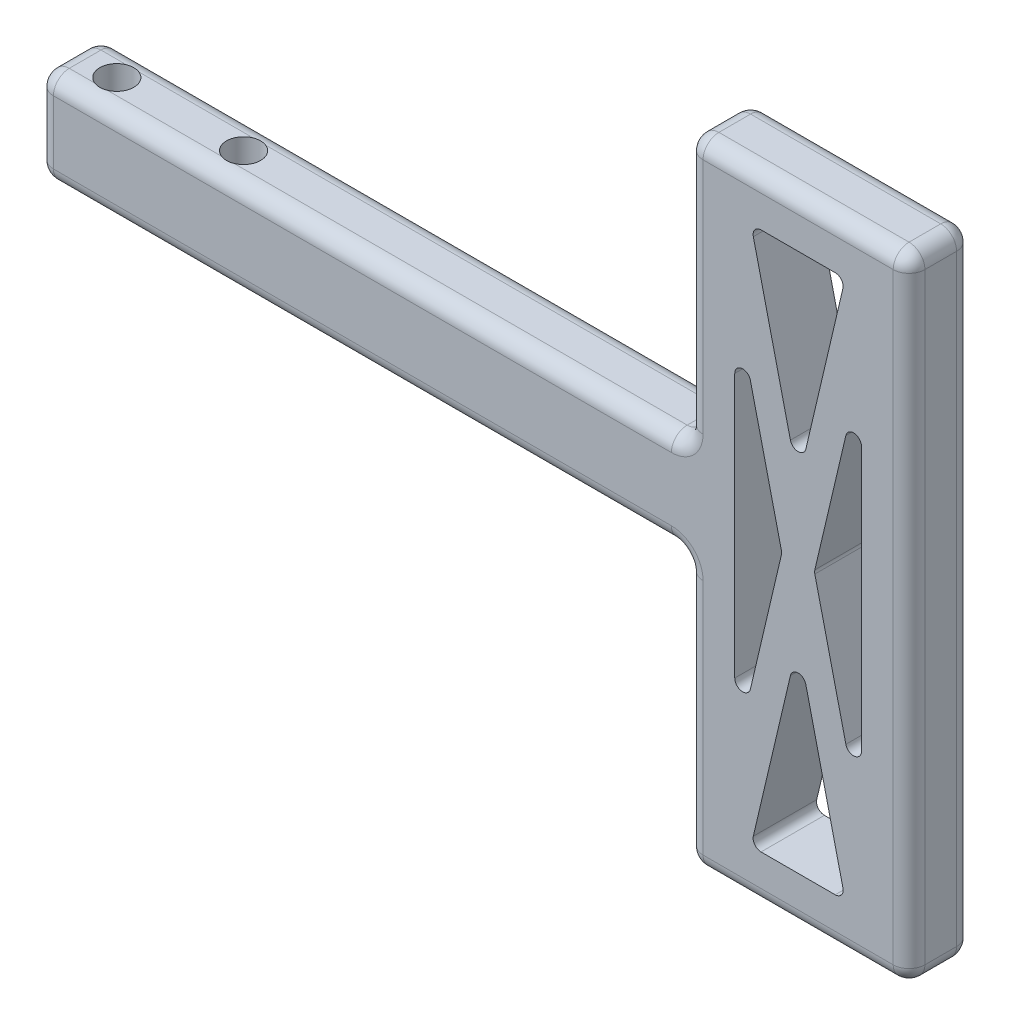
from build123d import *

# Parameters (mm, degrees)
BOSS_EXTRUDE1_DEPTH = 8
SKETCH2_R           = 2.15
CUT_EXTRUDE1_DEPTH  = 18
FILLET1_R           = 2
FILLET2_R           = 1


with BuildPart() as part:
    # Sketch1 → Boss-Extrude1 (new body)
    with BuildSketch(Plane.XY):
        Polygon((76, -6), (76, -40), (104, -40), (104, 40), (76, 40), (76, 6), (-6, 6), (-6, -6), align=None)
        Polygon((84.054617553, 34), (90, 8.732124598), (95.945382447, 34), align=None, mode=Mode.SUBTRACT)
        Polygon((82, 25.267875402), (82, -25.267875402), (87.945382447, 0), align=None, mode=Mode.SUBTRACT)
        Polygon((98, 25.267875402), (92.054617553, 0), (98, -25.267875402), align=None, mode=Mode.SUBTRACT)
        Polygon((84.054617553, -34), (95.945382447, -34), (90, -8.732124598), align=None, mode=Mode.SUBTRACT)
    extrude(amount=BOSS_EXTRUDE1_DEPTH)

    # Sketch2 → Cut-Extrude1 (cut)
    with BuildSketch(Plane.XZ.offset(6)):
        with Locations(Location((0, 4, 0), (0, 0, 270))):
            Circle(SKETCH2_R)
        with Locations(Location((16, 4, 0), (0, 0, 270))):
            Circle(SKETCH2_R)
    extrude(amount=-CUT_EXTRUDE1_DEPTH, mode=Mode.SUBTRACT)

    # Fillet1
    # the kernel refuses this fillet: 2 mm, written as the material it adds along each edge
    with BuildSketch(Plane(origin=(76, 6, 0), x_dir=(0, 1, 0), z_dir=(0, 0, 1))) as fillet1_piece_1:
        with BuildLine():
            CenterArc((FILLET1_R, FILLET1_R), FILLET1_R, 180, 90)
            Line((0, FILLET1_R), (0, 0))
            Line((0, 0), (FILLET1_R, 0))
        make_face()
    extrude(amount=8)
    with BuildSketch(Plane(origin=(76, -6, 0), x_dir=(0, -1, 0), z_dir=(0, 0, 1))) as fillet1_piece_2:
        with BuildLine():
            CenterArc((FILLET1_R, -FILLET1_R), FILLET1_R, 90, 90)
            Line((0, -FILLET1_R), (0, 0))
            Line((0, 0), (FILLET1_R, 0))
        make_face()
    extrude(amount=8)
    # the kernel refuses this fillet: 2 mm, written as the material it takes off along each edge
    with BuildSketch(Plane(origin=(102, -38, 2), x_dir=(0, -1, 0), z_dir=(0, 0, -1))) as fillet1_2_piece_1_section:
        Polygon((0, 0), (FILLET1_R, 0), (FILLET1_R, -FILLET1_R), (0, -FILLET1_R), align=None)
    fillet1_2_piece_1 = extrude(amount=FILLET1_R, mode=Mode.PRIVATE)
    fillet1_2_piece_1 = fillet1_2_piece_1 - Plane(origin=(102, -38, 2), x_dir=(-0.7071067811865475, 0.7071067811865475, 0), z_dir=(0, 0, -1)) * Sphere(FILLET1_R, mode=Mode.PRIVATE)
    add(fillet1_2_piece_1, mode=Mode.SUBTRACT)
    with BuildSketch(Plane(origin=(102, 38, 2), x_dir=(1, 0, 0), z_dir=(0, 0, -1))) as fillet1_2_piece_2_section:
        Polygon((0, 0), (FILLET1_R, 0), (FILLET1_R, -FILLET1_R), (0, -FILLET1_R), align=None)
    fillet1_2_piece_2 = extrude(amount=FILLET1_R, mode=Mode.PRIVATE)
    fillet1_2_piece_2 = fillet1_2_piece_2 - Plane(origin=(102, 38, 2), x_dir=(-0.7071067811865475, -0.7071067811865475, 0), z_dir=(0, 0, -1)) * Sphere(FILLET1_R, mode=Mode.PRIVATE)
    add(fillet1_2_piece_2, mode=Mode.SUBTRACT)
    with BuildSketch(Plane(origin=(102, 38, 6), x_dir=(1, 0, 0), z_dir=(0, 0, 1))) as fillet1_2_piece_3_section:
        Polygon((0, 0), (FILLET1_R, 0), (FILLET1_R, FILLET1_R), (0, FILLET1_R), align=None)
    fillet1_2_piece_3 = extrude(amount=FILLET1_R, mode=Mode.PRIVATE)
    fillet1_2_piece_3 = fillet1_2_piece_3 - Plane(origin=(102, 38, 6), x_dir=(-0.7071067811865475, -0.7071067811865475, 0), z_dir=(0, 0, 1)) * Sphere(FILLET1_R, mode=Mode.PRIVATE)
    add(fillet1_2_piece_3, mode=Mode.SUBTRACT)
    with BuildSketch(Plane(origin=(102, -38, 6), x_dir=(0, 0, 1), z_dir=(0, -1, 0))) as fillet1_2_piece_4_section:
        Polygon((0, 0), (FILLET1_R, 0), (FILLET1_R, -FILLET1_R), (0, -FILLET1_R), align=None)
    fillet1_2_piece_4 = extrude(amount=FILLET1_R, mode=Mode.PRIVATE)
    fillet1_2_piece_4 = fillet1_2_piece_4 - Plane(origin=(102, -38, 6), x_dir=(-0.7071067811865475, 0, -0.7071067811865475), z_dir=(0, -1, 0)) * Sphere(FILLET1_R, mode=Mode.PRIVATE)
    add(fillet1_2_piece_4, mode=Mode.SUBTRACT)
    with BuildSketch(Plane(origin=(71, -40, 0), x_dir=(0, 1, 0), z_dir=(1, 0, 0)), Plane(origin=(71, -40, 8), x_dir=(0, 0, -1), z_dir=(1, 0, 0)), Plane(origin=(102, 40, 0), x_dir=(0, -1, 0), z_dir=(-1, 0, 0))) as fillet1_2_piece_5:
        with BuildLine():
            CenterArc((FILLET1_R, FILLET1_R), FILLET1_R, 180, 90)
            Line((0, FILLET1_R), (0, 0))
            Line((0, 0), (FILLET1_R, 0))
        make_face()
    extrude(amount=31, mode=Mode.SUBTRACT)
    with BuildSketch(Plane(origin=(-6, 11, 0), x_dir=(1, 0, 0), z_dir=(0, -1, 0))) as fillet1_2_piece_6:
        with BuildLine():
            CenterArc((FILLET1_R, FILLET1_R), FILLET1_R, 180, 90)
            Line((0, FILLET1_R), (0, 0))
            Line((0, 0), (FILLET1_R, 0))
        make_face()
    extrude(amount=22, mode=Mode.SUBTRACT)
    with BuildSketch(Plane(origin=(-6, 6, -5), x_dir=(1, 0, 0), z_dir=(0, 0, 1)), Plane(origin=(76, 40, -5), x_dir=(1, 0, 0), z_dir=(0, 0, 1)), Plane(origin=(76, -40, -5), x_dir=(0, 1, 0), z_dir=(0, 0, 1)), Plane(origin=(-6, -6, -5), x_dir=(0, 1, 0), z_dir=(0, 0, 1))) as fillet1_2_piece_7:
        with BuildLine():
            CenterArc((FILLET1_R, -FILLET1_R), FILLET1_R, 90, 90)
            Line((0, -FILLET1_R), (0, 0))
            Line((0, 0), (FILLET1_R, 0))
        make_face()
    extrude(amount=18, mode=Mode.SUBTRACT)
    with BuildSketch(Plane(origin=(104, 40, 2), x_dir=(0, -1, 0), z_dir=(0, 0, 1)), Plane(origin=(104, -40, 2), x_dir=(-1, 0, 0), z_dir=(0, 0, 1))) as fillet1_2_piece_8:
        with BuildLine():
            CenterArc((FILLET1_R, -FILLET1_R), FILLET1_R, 90, 90)
            Line((0, -FILLET1_R), (0, 0))
            Line((0, 0), (FILLET1_R, 0))
        make_face()
    extrude(amount=4, mode=Mode.SUBTRACT)
    with BuildSketch(Plane(origin=(104, -38, 8), x_dir=(-1, 0, 0), z_dir=(0, 1, 0))) as fillet1_2_piece_9:
        with BuildLine():
            CenterArc((FILLET1_R, -FILLET1_R), FILLET1_R, 90, 90)
            Line((0, -FILLET1_R), (0, 0))
            Line((0, 0), (FILLET1_R, 0))
        make_face()
    extrude(amount=76, mode=Mode.SUBTRACT)
    with BuildSketch(Plane(origin=(102, 40, 8), x_dir=(0, -1, 0), z_dir=(-1, 0, 0))) as fillet1_2_piece_10:
        with BuildLine():
            CenterArc((FILLET1_R, -FILLET1_R), FILLET1_R, 90, 90)
            Line((0, -FILLET1_R), (0, 0))
            Line((0, 0), (FILLET1_R, 0))
        make_face()
    extrude(amount=31, mode=Mode.SUBTRACT)
    with BuildSketch(Plane(origin=(-6, 11, 8), x_dir=(1, 0, 0), z_dir=(0, -1, 0))) as fillet1_2_piece_11:
        with BuildLine():
            CenterArc((FILLET1_R, -FILLET1_R), FILLET1_R, 90, 90)
            Line((0, -FILLET1_R), (0, 0))
            Line((0, 0), (FILLET1_R, 0))
        make_face()
    extrude(amount=22, mode=Mode.SUBTRACT)
    with BuildSketch(Plane(origin=(104, -38, 0), x_dir=(-1, 0, 0), z_dir=(0, 1, 0))) as fillet1_2_piece_12:
        with BuildLine():
            CenterArc((FILLET1_R, FILLET1_R), FILLET1_R, 180, 90)
            Line((0, FILLET1_R), (0, 0))
            Line((0, 0), (FILLET1_R, 0))
        make_face()
    extrude(amount=76, mode=Mode.SUBTRACT)
    # the kernel refuses this fillet: 2 mm, written as the material it takes off along each edge
    with BuildSketch(Plane(origin=(78, 38, 2), x_dir=(-1, 0, 0), z_dir=(0, 0, -1))) as fillet1_3_piece_1_section:
        Polygon((0, 0), (FILLET1_R, 0), (FILLET1_R, FILLET1_R), (0, FILLET1_R), align=None)
    fillet1_3_piece_1 = extrude(amount=FILLET1_R, mode=Mode.PRIVATE)
    fillet1_3_piece_1 = fillet1_3_piece_1 - Plane(origin=(78, 38, 2), x_dir=(0.7071067811865474, -0.7071067811865477, 0), z_dir=(0, 0, -1)) * Sphere(FILLET1_R, mode=Mode.PRIVATE)
    add(fillet1_3_piece_1, mode=Mode.SUBTRACT)
    with BuildSketch(Plane(origin=(-4, -4, 6), x_dir=(0, -1, 0), z_dir=(0, 0, 1))) as fillet1_3_piece_2_section:
        Polygon((0, 0), (FILLET1_R, 0), (FILLET1_R, -FILLET1_R), (0, -FILLET1_R), align=None)
    fillet1_3_piece_2 = extrude(amount=FILLET1_R, mode=Mode.PRIVATE)
    fillet1_3_piece_2 = fillet1_3_piece_2 - Plane(origin=(-4, -4, 6), x_dir=(0.7071067811865475, 0.7071067811865475, 0), z_dir=(0, 0, 1)) * Sphere(FILLET1_R, mode=Mode.PRIVATE)
    add(fillet1_3_piece_2, mode=Mode.SUBTRACT)
    with BuildSketch(Plane(origin=(-4, 4, 2), x_dir=(0, 1, 0), z_dir=(0, 0, -1))) as fillet1_3_piece_3_section:
        Polygon((0, 0), (FILLET1_R, 0), (FILLET1_R, -FILLET1_R), (0, -FILLET1_R), align=None)
    fillet1_3_piece_3 = extrude(amount=FILLET1_R, mode=Mode.PRIVATE)
    fillet1_3_piece_3 = fillet1_3_piece_3 - Plane(origin=(-4, 4, 2), x_dir=(0.7071067811865475, -0.7071067811865475, 0), z_dir=(0, 0, -1)) * Sphere(FILLET1_R, mode=Mode.PRIVATE)
    add(fillet1_3_piece_3, mode=Mode.SUBTRACT)
    with BuildSketch(Plane(origin=(-4, 4, 6), x_dir=(0, 1, 0), z_dir=(0, 0, 1))) as fillet1_3_piece_4_section:
        Polygon((0, 0), (FILLET1_R, 0), (FILLET1_R, FILLET1_R), (0, FILLET1_R), align=None)
    fillet1_3_piece_4 = extrude(amount=FILLET1_R, mode=Mode.PRIVATE)
    fillet1_3_piece_4 = fillet1_3_piece_4 - Plane(origin=(-4, 4, 6), x_dir=(0.7071067811865475, -0.7071067811865475, 0), z_dir=(0, 0, 1)) * Sphere(FILLET1_R, mode=Mode.PRIVATE)
    add(fillet1_3_piece_4, mode=Mode.SUBTRACT)
    with BuildSketch(Plane(origin=(78, 38, 6), x_dir=(-1, 0, 0), z_dir=(0, 0, 1))) as fillet1_3_piece_5_section:
        Polygon((0, 0), (FILLET1_R, 0), (FILLET1_R, -FILLET1_R), (0, -FILLET1_R), align=None)
    fillet1_3_piece_5 = extrude(amount=FILLET1_R, mode=Mode.PRIVATE)
    fillet1_3_piece_5 = fillet1_3_piece_5 - Plane(origin=(78, 38, 6), x_dir=(0.7071067811865474, -0.7071067811865477, 0), z_dir=(0, 0, 1)) * Sphere(FILLET1_R, mode=Mode.PRIVATE)
    add(fillet1_3_piece_5, mode=Mode.SUBTRACT)
    with BuildSketch(Plane(origin=(78, -38, 6), x_dir=(0, 0, 1), z_dir=(-1, 0, 0))) as fillet1_3_piece_6_section:
        Polygon((0, 0), (FILLET1_R, 0), (FILLET1_R, -FILLET1_R), (0, -FILLET1_R), align=None)
    fillet1_3_piece_6 = extrude(amount=FILLET1_R, mode=Mode.PRIVATE)
    fillet1_3_piece_6 = fillet1_3_piece_6 - Plane(origin=(78, -38, 6), x_dir=(0, 0.7071067811865475, -0.7071067811865475), z_dir=(-1, 0, 0)) * Sphere(FILLET1_R, mode=Mode.PRIVATE)
    add(fillet1_3_piece_6, mode=Mode.SUBTRACT)
    with BuildSketch(Plane(origin=(-4, -4, 2), x_dir=(0, -1, 0), z_dir=(0, 0, -1))) as fillet1_3_piece_7_section:
        Polygon((0, 0), (FILLET1_R, 0), (FILLET1_R, FILLET1_R), (0, FILLET1_R), align=None)
    fillet1_3_piece_7 = extrude(amount=FILLET1_R, mode=Mode.PRIVATE)
    fillet1_3_piece_7 = fillet1_3_piece_7 - Plane(origin=(-4, -4, 2), x_dir=(0.7071067811865475, 0.7071067811865475, 0), z_dir=(0, 0, -1)) * Sphere(FILLET1_R, mode=Mode.PRIVATE)
    add(fillet1_3_piece_7, mode=Mode.SUBTRACT)
    with BuildSketch(Plane(origin=(78, -38, 2), x_dir=(0, 0, -1), z_dir=(-1, 0, 0))) as fillet1_3_piece_8_section:
        Polygon((0, 0), (FILLET1_R, 0), (FILLET1_R, FILLET1_R), (0, FILLET1_R), align=None)
    fillet1_3_piece_8 = extrude(amount=FILLET1_R, mode=Mode.PRIVATE)
    fillet1_3_piece_8 = fillet1_3_piece_8 - Plane(origin=(78, -38, 2), x_dir=(0, 0.7071067811865475, 0.7071067811865475), z_dir=(-1, 0, 0)) * Sphere(FILLET1_R, mode=Mode.PRIVATE)
    add(fillet1_3_piece_8, mode=Mode.SUBTRACT)
    with BuildSketch(Plane(origin=(76, -8, 0), x_dir=(0, 0, 1), z_dir=(0, -1, 0)), Plane(origin=(76, 38, 8), x_dir=(1, 0, 0), z_dir=(0, -1, 0))) as fillet1_3_piece_9:
        with BuildLine():
            CenterArc((FILLET1_R, -FILLET1_R), FILLET1_R, 90, 90)
            Line((0, -FILLET1_R), (0, 0))
            Line((0, 0), (FILLET1_R, 0))
        make_face()
    extrude(amount=30, mode=Mode.SUBTRACT)
    with BuildSketch(Plane(origin=(-4, -6, 0), x_dir=(0, 1, 0), z_dir=(1, 0, 0)), Plane(origin=(74, 6, 0), x_dir=(0, -1, 0), z_dir=(-1, 0, 0))) as fillet1_3_piece_10:
        with BuildLine():
            CenterArc((FILLET1_R, FILLET1_R), FILLET1_R, 180, 90)
            Line((0, FILLET1_R), (0, 0))
            Line((0, 0), (FILLET1_R, 0))
        make_face()
    extrude(amount=78, mode=Mode.SUBTRACT)
    with BuildSketch(Plane(origin=(76, -8, 8), x_dir=(0, 0, -1), z_dir=(0, -1, 0)), Plane(origin=(76, 38, 0), x_dir=(1, 0, 0), z_dir=(0, -1, 0))) as fillet1_3_piece_11:
        with BuildLine():
            CenterArc((FILLET1_R, FILLET1_R), FILLET1_R, 180, 90)
            Line((0, FILLET1_R), (0, 0))
            Line((0, 0), (FILLET1_R, 0))
        make_face()
    extrude(amount=30, mode=Mode.SUBTRACT)
    with BuildSketch(Plane(origin=(74, 6, 8), x_dir=(0, -1, 0), z_dir=(-1, 0, 0)), Plane(origin=(-4, -6, 8), x_dir=(0, 1, 0), z_dir=(1, 0, 0))) as fillet1_3_piece_12:
        with BuildLine():
            CenterArc((FILLET1_R, -FILLET1_R), FILLET1_R, 90, 90)
            Line((0, -FILLET1_R), (0, 0))
            Line((0, 0), (FILLET1_R, 0))
        make_face()
    extrude(amount=78, mode=Mode.SUBTRACT)
    with BuildSketch(Plane(origin=(74, 8, 0), x_dir=(1, 0, 0), z_dir=(0, 1, 0))) as fillet1_3_piece_13:
        with BuildLine():
            CenterArc((2 + FILLET1_R, -FILLET1_R), FILLET1_R, 90, 90)
            Line((2, -FILLET1_R), (2, 0))
            Line((2, 0), (2 + FILLET1_R, 0))
        make_face()
    revolve(axis=Axis((74, 8, 0), (0, 0, -1)), revolution_arc=90, mode=Mode.SUBTRACT)
    with BuildSketch(Plane(origin=(74, -8, 8), x_dir=(1, 0, 0), z_dir=(0, -1, 0))) as fillet1_3_piece_14:
        with BuildLine():
            CenterArc((2 + FILLET1_R, -FILLET1_R), FILLET1_R, 90, 90)
            Line((2, -FILLET1_R), (2, 0))
            Line((2, 0), (2 + FILLET1_R, 0))
        make_face()
    revolve(axis=Axis((74, -8, 8), (0, 0, 1)), revolution_arc=90, mode=Mode.SUBTRACT)
    with BuildSketch(Plane(origin=(74, 8, 8), x_dir=(1, 0, 0), z_dir=(0, 1, 0))) as fillet1_3_piece_15:
        with BuildLine():
            CenterArc((2 + FILLET1_R, FILLET1_R), FILLET1_R, 180, 90)
            Line((2, FILLET1_R), (2, 0))
            Line((2, 0), (2 + FILLET1_R, 0))
        make_face()
    revolve(axis=Axis((74, 8, 8), (0, 0, -1)), revolution_arc=90, mode=Mode.SUBTRACT)
    with BuildSketch(Plane(origin=(74, -8, 0), x_dir=(1, 0, 0), z_dir=(0, -1, 0))) as fillet1_3_piece_16:
        with BuildLine():
            CenterArc((2 + FILLET1_R, FILLET1_R), FILLET1_R, 180, 90)
            Line((2, FILLET1_R), (2, 0))
            Line((2, 0), (2 + FILLET1_R, 0))
        make_face()
    revolve(axis=Axis((74, -8, 0), (0, 0, 1)), revolution_arc=90, mode=Mode.SUBTRACT)

    # Fillet2
    fillet2_edges = [part.edges().sort_by_distance(p)[0] for p in [
        (95.945382447, 34, 4),
        (84.054617553, 34, 4),
        (90, 8.732124598, 4),
        (87.945382447, 0, 4),
        (82, 25.267875402, 4),
        (82, -25.267875402, 4),
        (90, -8.732124598, 4),
        (84.054617553, -34, 4),
        (95.945382447, -34, 4),
        (98, -25.267875402, 4),
        (98, 25.267875402, 4),
        (92.054617553, 0, 4),
    ]]
    fillet(fillet2_edges, radius=FILLET2_R)


solid = part.part
